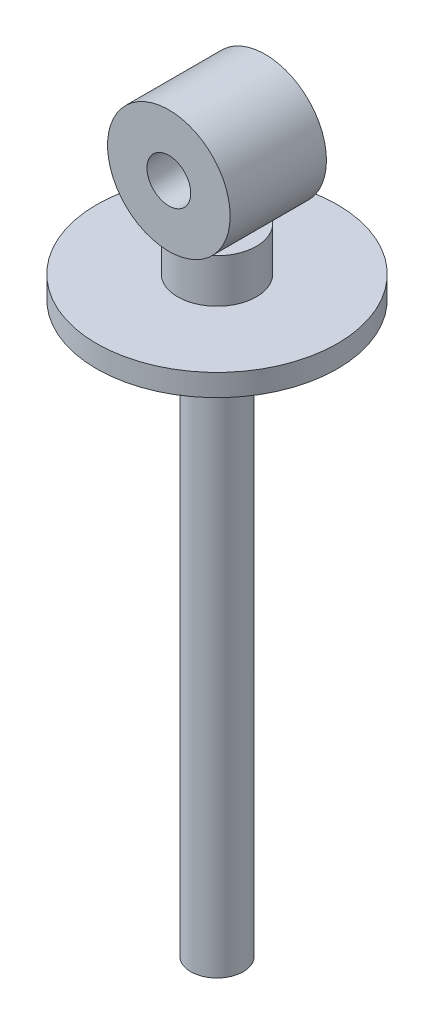
from build123d import *

# Parameters (mm, degrees)
SKETCH_1_R      = 27.5
EXTRUDE_1_DEPTH = 5
SKETCH_2_R      = 9
EXTRUDE_2_DEPTH = 10
SKETCH_3_R      = 14
SKETCH_3_R_2    = 5
EXTRUDE_3_DEPTH = 11
SKETCH_4_R      = 6
EXTRUDE_4_DEPTH = 130


with BuildPart() as part:
    # Эскиз1 → Бобышка-Вытянуть1 (new body)
    with BuildSketch(Plane(origin=(0, 0, 0), x_dir=(1, 0, 0), z_dir=(0, 1, 0))):
        Circle(SKETCH_1_R)
    extrude(amount=EXTRUDE_1_DEPTH)

    # Эскиз2 → Бобышка-Вытянуть2 (add)
    with BuildSketch(Plane(origin=(0, 5, 0), x_dir=(1, 0, 0), z_dir=(0, 1, 0))):
        Circle(SKETCH_2_R)
    extrude(amount=EXTRUDE_2_DEPTH)

    # Эскиз4 → Бобышка-Вытянуть4 (add)
    with BuildSketch(Plane.XZ):
        Circle(SKETCH_4_R)
    extrude(amount=EXTRUDE_4_DEPTH)


with BuildPart() as body_2:
    # Эскиз3 → Бобышка-Вытянуть3 (new, symmetric)
    with BuildSketch(Plane.XY):
        with Locations((0, 29)):
            Circle(SKETCH_3_R)
        with Locations((0, 29)):
            Circle(SKETCH_3_R_2, mode=Mode.SUBTRACT)
    extrude(amount=EXTRUDE_3_DEPTH, both=True)


solid = Compound([part.part, body_2.part])
